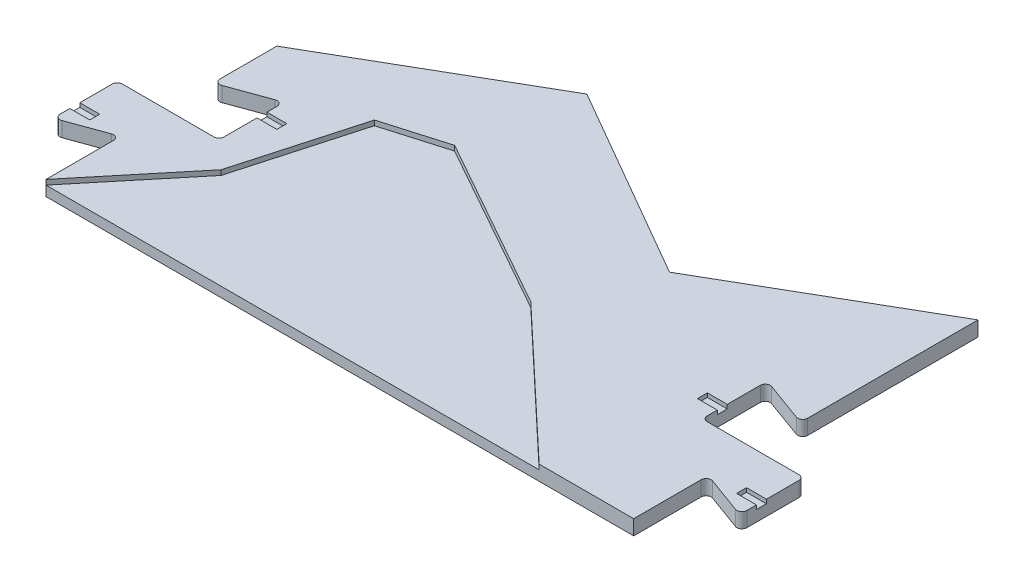
from build123d import *

# Parameters (mm, degrees)
P_IDAT_VYSUNUT_M1_DEPTH  = 3
P_IDAT_VYSUNUT_M2_DEPTH  = 2
ZAOBLIT3_R               = 1
SKICA2_W                 = 4
SKICA2_H                 = 2
ODEBRAT_VYSUNUT_M1_DEPTH = 0.8


with BuildPart() as part:
    # Skica1 → Přidat vysunutím1 (new body)
    with BuildSketch(Plane(origin=(0, 0, 0), x_dir=(1, 0, 0), z_dir=(0, 1, 0))):
        Polygon((-118.143750166, 15), (-118.143750166, 0), (-102.227105248, 19.278496169), (-95.473037065, 43.348863075), (-82.997228437, 47.003202833), (-48.112980408, 27.430537213), (-19, 0), (0, 0), (0, 15), (9.950504516, 11.37831254), (9.950504516, 24.27831254), (-10.5, 24.27831254), (-10.5, 37.37831254), (0, 33.55662508), (0, 69.224902673), (-39.317553332, 46.524902673), (-78.635106664, 69.224902673), (-118.143185584, 46.414902673), (-118.143185584, 33.5570142), (-107.643750166, 37.378496169), (-107.643750166, 24.278496169), (-128.093750166, 24.278496169), (-128.093750166, 11.378496169), align=None)
    extrude(amount=P_IDAT_VYSUNUT_M1_DEPTH)

    # Skica1<3> → Přidat vysunutím2 (add)
    with BuildSketch(Plane(origin=(0, 0, 0), x_dir=(1, 0, 0), z_dir=(0, 1, 0))):
        Polygon((-102.227105248, 19.278496169), (-118.143750166, 0), (-19, 0), (-48.112980408, 27.430537213), (-82.997228437, 47.003202833), (-95.473037065, 43.348863075), align=None)
    extrude(amount=P_IDAT_VYSUNUT_M2_DEPTH)

    # Zaoblit3
    zaoblit3_edges = [part.edges().sort_by_distance(p)[0] for p in [
        (-107.643750166, 1.5, -24.278496169),
        (0, 1.5, -15),
        (9.950504516, 1.5, -11.37831254),
        (9.950504516, 1.5, -24.27831254),
        (-10.5, 1.5, -24.27831254),
        (-10.5, 1.5, -37.37831254),
        (0, 1.5, -33.55662508),
        (-118.143750166, 1.5, -15),
        (-128.093750166, 1.5, -11.378496169),
        (-128.093750166, 1.5, -24.278496169),
        (-107.643750166, 1.5, -37.378496169),
        (-118.143185584, 1.5, -33.5570142),
    ]]
    fillet(zaoblit3_edges, radius=ZAOBLIT3_R)

    # Skica2 → Odebrat vysunutím1 (cut)
    with BuildSketch(Plane(origin=(0, 3, 0), x_dir=(1, 0, 0), z_dir=(0, 1, 0))):
        with Locations((-105.643750166, 32.914422166)):
            Rectangle(SKICA2_W, SKICA2_H)
        with Locations((-126.093750166, 15.742570172)):
            Rectangle(SKICA2_W, SKICA2_H)
        with Locations((7.950504516, 15.742386544)):
            Rectangle(SKICA2_W, SKICA2_H)
        with Locations((-12.5, 28.314238537)):
            Rectangle(SKICA2_W, SKICA2_H)
    extrude(amount=-ODEBRAT_VYSUNUT_M1_DEPTH, mode=Mode.SUBTRACT)


solid = part.part
